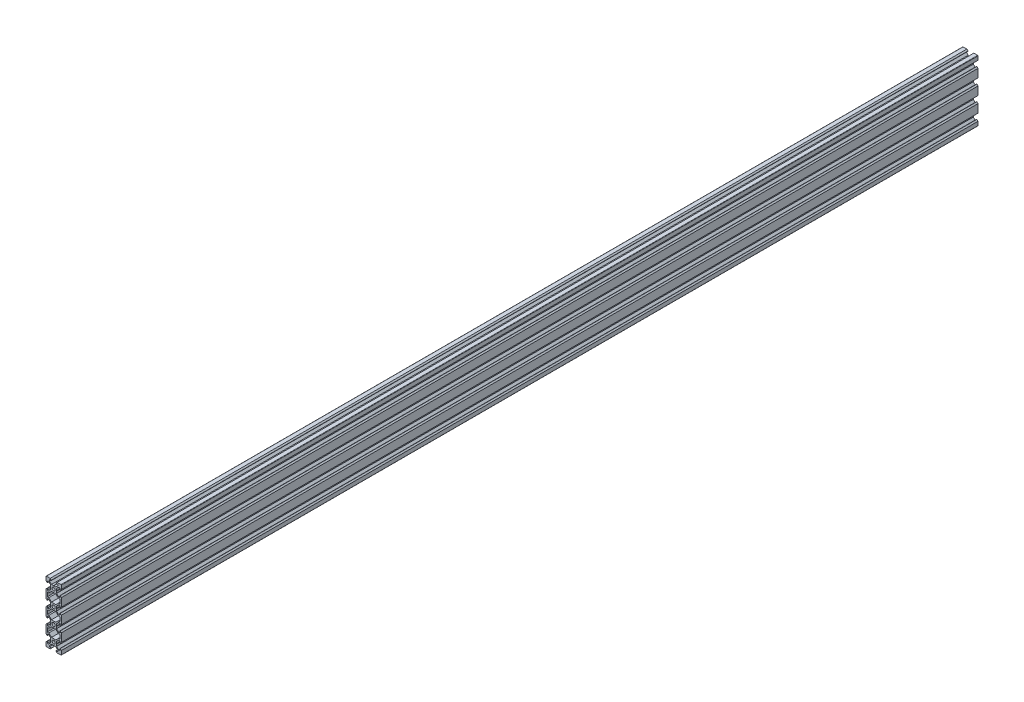
from build123d import *

# Parameters (mm, degrees)
V_SLOT_START                            = -48.53464623
V_SLOT_20X80X1000_LINEAR_RAIL_OUTLINE_R = 2.1
V_SLOT_20X80X1000_LINEAR_RAIL_DEPTH     = 1000
BOSS_EXTRUDE1_START                     = 200
SKETCH1_R                               = 2.1
BOSS_EXTRUDE1_DEPTH                     = 200


# Read off the part's stored shape, not the designer's step: V-Slot 20x80x1000 Linear Rail
with BuildPart() as part:
    # V-Slot 20x80x1000 Linear Rail outline → V-Slot 20x80x1000 Linear Rail (new body)
    with BuildSketch(Plane.XY.offset(V_SLOT_START)):
        with BuildLine():
            Line((20.643413128, 85.594922365), (20.643413128, 88.224262193))
            Line((20.643413128, 88.224262193), (20.433413128, 88.434262193))
            Line((20.433413128, 88.434262193), (20.643413128, 88.644262193))
            Line((20.643413128, 88.644262193), (20.643413128, 91.273602021))
            Line((20.643413128, 91.273602021), (23.3040733, 93.934262193))
            Line((23.3040733, 93.934262193), (24.943413128, 93.934262193))
            Line((24.943413128, 93.934262193), (24.943413128, 91.559262193))
            Line((24.943413128, 91.559262193), (25.288413128, 91.559262193))
            Line((25.288413128, 91.559262193), (26.743413128, 93.014262193))
            Line((26.743413128, 93.014262193), (26.743413128, 97.934262193))
            ThreePointArc((26.743413128, 97.934262193), (26.596966518, 98.287815583), (26.243413128, 98.434262193))
            Line((26.243413128, 98.434262193), (21.323413128, 98.434262193))
            Line((21.323413128, 98.434262193), (19.868413128, 96.979262193))
            Line((19.868413128, 96.979262193), (19.868413128, 96.634262193))
            Line((19.868413128, 96.634262193), (22.243413128, 96.634262193))
            Line((22.243413128, 96.634262193), (22.243413128, 94.994922365))
            Line((22.243413128, 94.994922365), (19.582752956, 92.334262193))
            Line((19.582752956, 92.334262193), (16.953413128, 92.334262193))
            Line((16.953413128, 92.334262193), (16.743413128, 92.124262193))
            Line((16.743413128, 92.124262193), (16.533413128, 92.334262193))
            Line((16.533413128, 92.334262193), (13.9040733, 92.334262193))
            Line((13.9040733, 92.334262193), (11.243413128, 94.994922365))
            Line((11.243413128, 94.994922365), (11.243413128, 96.634262193))
            Line((11.243413128, 96.634262193), (13.618413128, 96.634262193))
            Line((13.618413128, 96.634262193), (13.618413128, 96.979262193))
            Line((13.618413128, 96.979262193), (12.163413128, 98.434262193))
            Line((12.163413128, 98.434262193), (7.243413128, 98.434262193))
            ThreePointArc((7.243413128, 98.434262193), (6.889859737, 98.287815583), (6.743413128, 97.934262193))
            Line((6.743413128, 97.934262193), (6.743413128, 93.014262193))
            Line((6.743413128, 93.014262193), (8.198413128, 91.559262193))
            Line((8.198413128, 91.559262193), (8.543413128, 91.559262193))
            Line((8.543413128, 91.559262193), (8.543413128, 93.934262193))
            Line((8.543413128, 93.934262193), (10.182752956, 93.934262193))
            Line((10.182752956, 93.934262193), (12.843413128, 91.273602021))
            Line((12.843413128, 91.273602021), (12.843413128, 88.644262193))
            Line((12.843413128, 88.644262193), (13.053413128, 88.434262193))
            Line((13.053413128, 88.434262193), (12.843413128, 88.224262193))
            Line((12.843413128, 88.224262193), (12.843413128, 85.594922365))
            Line((12.843413128, 85.594922365), (10.182752956, 82.934262193))
            Line((10.182752956, 82.934262193), (8.543413128, 82.934262193))
            Line((8.543413128, 82.934262193), (8.543413128, 85.309262193))
            Line((8.543413128, 85.309262193), (8.198413128, 85.309262193))
            Line((8.198413128, 85.309262193), (6.743413128, 83.854262193))
            Line((6.743413128, 83.854262193), (6.743413128, 73.014262193))
            Line((6.743413128, 73.014262193), (8.198413128, 71.559262193))
            Line((8.198413128, 71.559262193), (8.543413128, 71.559262193))
            Line((8.543413128, 71.559262193), (8.543413128, 73.934262193))
            Line((8.543413128, 73.934262193), (10.182752956, 73.934262193))
            Line((10.182752956, 73.934262193), (12.843413128, 71.273602021))
            Line((12.843413128, 71.273602021), (12.843413128, 68.644262193))
            Line((12.843413128, 68.644262193), (13.053413128, 68.434262193))
            Line((13.053413128, 68.434262193), (12.843413128, 68.224262193))
            Line((12.843413128, 68.224262193), (12.843413128, 65.594922365))
            Line((12.843413128, 65.594922365), (10.182752956, 62.934262193))
            Line((10.182752956, 62.934262193), (8.543413128, 62.934262193))
            Line((8.543413128, 62.934262193), (8.543413128, 65.309262193))
            Line((8.543413128, 65.309262193), (8.198413128, 65.309262193))
            Line((8.198413128, 65.309262193), (6.743413128, 63.854262193))
            Line((6.743413128, 63.854262193), (6.743413128, 53.014262193))
            Line((6.743413128, 53.014262193), (8.198413128, 51.559262193))
            Line((8.198413128, 51.559262193), (8.543413128, 51.559262193))
            Line((8.543413128, 51.559262193), (8.543413128, 53.934262193))
            Line((8.543413128, 53.934262193), (10.182752956, 53.934262193))
            Line((10.182752956, 53.934262193), (12.843413128, 51.273602021))
            Line((12.843413128, 51.273602021), (12.843413128, 48.644262193))
            Line((12.843413128, 48.644262193), (13.053413128, 48.434262193))
            Line((13.053413128, 48.434262193), (12.843413128, 48.224262193))
            Line((12.843413128, 48.224262193), (12.843413128, 45.594922365))
            Line((12.843413128, 45.594922365), (10.182752956, 42.934262193))
            Line((10.182752956, 42.934262193), (8.543413128, 42.934262193))
            Line((8.543413128, 42.934262193), (8.543413128, 45.309262193))
            Line((8.543413128, 45.309262193), (8.198413128, 45.309262193))
            Line((8.198413128, 45.309262193), (6.743413128, 43.854262193))
            Line((6.743413128, 43.854262193), (6.743413128, 33.014262193))
            Line((6.743413128, 33.014262193), (8.198413128, 31.559262193))
            Line((8.198413128, 31.559262193), (8.543413128, 31.559262193))
            Line((8.543413128, 31.559262193), (8.543413128, 33.934262193))
            Line((8.543413128, 33.934262193), (10.182752956, 33.934262193))
            Line((10.182752956, 33.934262193), (12.843413128, 31.273602021))
            Line((12.843413128, 31.273602021), (12.843413128, 28.644262193))
            Line((12.843413128, 28.644262193), (13.053413128, 28.434262193))
            Line((13.053413128, 28.434262193), (12.843413128, 28.224262193))
            Line((12.843413128, 28.224262193), (12.843413128, 25.594922365))
            Line((12.843413128, 25.594922365), (10.182752956, 22.934262193))
            Line((10.182752956, 22.934262193), (8.543413128, 22.934262193))
            Line((8.543413128, 22.934262193), (8.543413128, 25.309262193))
            Line((8.543413128, 25.309262193), (8.198413128, 25.309262193))
            Line((8.198413128, 25.309262193), (6.743413128, 23.854262193))
            Line((6.743413128, 23.854262193), (6.743413128, 18.934262193))
            ThreePointArc((6.743413128, 18.934262193), (6.889859737, 18.580708802), (7.243413128, 18.434262193))
            Line((7.243413128, 18.434262193), (12.163413128, 18.434262193))
            Line((12.163413128, 18.434262193), (13.618413128, 19.889262193))
            Line((13.618413128, 19.889262193), (13.618413128, 20.234262193))
            Line((13.618413128, 20.234262193), (11.243413128, 20.234262193))
            Line((11.243413128, 20.234262193), (11.243413128, 21.873602021))
            Line((11.243413128, 21.873602021), (13.9040733, 24.534262193))
            Line((13.9040733, 24.534262193), (16.533413128, 24.534262193))
            Line((16.533413128, 24.534262193), (16.743413128, 24.744262193))
            Line((16.743413128, 24.744262193), (16.953413128, 24.534262193))
            Line((16.953413128, 24.534262193), (19.582752956, 24.534262193))
            Line((19.582752956, 24.534262193), (22.243413128, 21.873602021))
            Line((22.243413128, 21.873602021), (22.243413128, 20.234262193))
            Line((22.243413128, 20.234262193), (19.868413128, 20.234262193))
            Line((19.868413128, 20.234262193), (19.868413128, 19.889262193))
            Line((19.868413128, 19.889262193), (21.323413128, 18.434262193))
            Line((21.323413128, 18.434262193), (26.243413128, 18.434262193))
            ThreePointArc((26.243413128, 18.434262193), (26.596966519, 18.580708802), (26.743413128, 18.934262193))
            Line((26.743413128, 18.934262193), (26.743413128, 23.854262193))
            Line((26.743413128, 23.854262193), (25.288413128, 25.309262193))
            Line((25.288413128, 25.309262193), (24.943413128, 25.309262193))
            Line((24.943413128, 25.309262193), (24.943413128, 22.934262193))
            Line((24.943413128, 22.934262193), (23.3040733, 22.934262193))
            Line((23.3040733, 22.934262193), (20.643413128, 25.594922365))
            Line((20.643413128, 25.594922365), (20.643413128, 28.224262193))
            Line((20.643413128, 28.224262193), (20.433413128, 28.434262193))
            Line((20.433413128, 28.434262193), (20.643413128, 28.644262193))
            Line((20.643413128, 28.644262193), (20.643413128, 31.273602021))
            Line((20.643413128, 31.273602021), (23.3040733, 33.934262193))
            Line((23.3040733, 33.934262193), (24.943413128, 33.934262193))
            Line((24.943413128, 33.934262193), (24.943413128, 31.559262193))
            Line((24.943413128, 31.559262193), (25.288413128, 31.559262193))
            Line((25.288413128, 31.559262193), (26.743413128, 33.014262193))
            Line((26.743413128, 33.014262193), (26.743413128, 43.854262193))
            Line((26.743413128, 43.854262193), (25.288413128, 45.309262193))
            Line((25.288413128, 45.309262193), (24.943413128, 45.309262193))
            Line((24.943413128, 45.309262193), (24.943413128, 42.934262193))
            Line((24.943413128, 42.934262193), (23.3040733, 42.934262193))
            Line((23.3040733, 42.934262193), (20.643413128, 45.594922365))
            Line((20.643413128, 45.594922365), (20.643413128, 48.224262193))
            Line((20.643413128, 48.224262193), (20.433413128, 48.434262193))
            Line((20.433413128, 48.434262193), (20.643413128, 48.644262193))
            Line((20.643413128, 48.644262193), (20.643413128, 51.273602021))
            Line((20.643413128, 51.273602021), (23.3040733, 53.934262193))
            Line((23.3040733, 53.934262193), (24.943413128, 53.934262193))
            Line((24.943413128, 53.934262193), (24.943413128, 51.559262193))
            Line((24.943413128, 51.559262193), (25.288413128, 51.559262193))
            Line((25.288413128, 51.559262193), (26.743413128, 53.014262193))
            Line((26.743413128, 53.014262193), (26.743413128, 63.854262193))
            Line((26.743413128, 63.854262193), (25.288413128, 65.309262193))
            Line((25.288413128, 65.309262193), (24.943413128, 65.309262193))
            Line((24.943413128, 65.309262193), (24.943413128, 62.934262193))
            Line((24.943413128, 62.934262193), (23.3040733, 62.934262193))
            Line((23.3040733, 62.934262193), (20.643413128, 65.594922365))
            Line((20.643413128, 65.594922365), (20.643413128, 68.224262193))
            Line((20.643413128, 68.224262193), (20.433413128, 68.434262193))
            Line((20.433413128, 68.434262193), (20.643413128, 68.644262193))
            Line((20.643413128, 68.644262193), (20.643413128, 71.273602021))
            Line((20.643413128, 71.273602021), (23.3040733, 73.934262193))
            Line((23.3040733, 73.934262193), (24.943413128, 73.934262193))
            Line((24.943413128, 73.934262193), (24.943413128, 71.559262193))
            Line((24.943413128, 71.559262193), (25.288413128, 71.559262193))
            Line((25.288413128, 71.559262193), (26.743413128, 73.014262193))
            Line((26.743413128, 73.014262193), (26.743413128, 83.854262193))
            Line((26.743413128, 83.854262193), (25.288413128, 85.309262193))
            Line((25.288413128, 85.309262193), (24.943413128, 85.309262193))
            Line((24.943413128, 85.309262193), (24.943413128, 82.934262193))
            Line((24.943413128, 82.934262193), (23.3040733, 82.934262193))
            Line((23.3040733, 82.934262193), (20.643413128, 85.594922365))
        make_face()
        with Locations((16.743413128, 28.434262193)):
            Circle(V_SLOT_20X80X1000_LINEAR_RAIL_OUTLINE_R, mode=Mode.SUBTRACT)
        Polygon((13.9040733, 32.334262193), (10.5040733, 35.734262193), (8.543413128, 35.734262193), (8.543413128, 41.134262193), (10.5040733, 41.134262193), (13.9040733, 44.534262193), (19.582752956, 44.534262193), (22.982752956, 41.134262193), (24.943413128, 41.134262193), (24.943413128, 35.734262193), (22.982752956, 35.734262193), (19.582752956, 32.334262193), align=None, mode=Mode.SUBTRACT)
        with Locations((16.743413128, 48.434262193)):
            Circle(V_SLOT_20X80X1000_LINEAR_RAIL_OUTLINE_R, mode=Mode.SUBTRACT)
        Polygon((13.9040733, 52.334262193), (10.5040733, 55.734262193), (8.543413128, 55.734262193), (8.543413128, 61.134262193), (10.5040733, 61.134262193), (13.9040733, 64.534262193), (19.582752956, 64.534262193), (22.982752956, 61.134262193), (24.943413128, 61.134262193), (24.943413128, 55.734262193), (22.982752956, 55.734262193), (19.582752956, 52.334262193), align=None, mode=Mode.SUBTRACT)
        with Locations((16.743413128, 68.434262193)):
            Circle(V_SLOT_20X80X1000_LINEAR_RAIL_OUTLINE_R, mode=Mode.SUBTRACT)
        Polygon((13.9040733, 72.334262193), (10.5040733, 75.734262193), (8.543413128, 75.734262193), (8.543413128, 81.134262193), (10.5040733, 81.134262193), (13.9040733, 84.534262193), (19.582752956, 84.534262193), (22.982752956, 81.134262193), (24.943413128, 81.134262193), (24.943413128, 75.734262193), (22.982752956, 75.734262193), (19.582752956, 72.334262193), align=None, mode=Mode.SUBTRACT)
        with Locations((16.743413128, 88.434262193)):
            Circle(V_SLOT_20X80X1000_LINEAR_RAIL_OUTLINE_R, mode=Mode.SUBTRACT)
    extrude(amount=V_SLOT_20X80X1000_LINEAR_RAIL_DEPTH)

    # Sketch1 → Boss-Extrude1 (add)
    with BuildSketch(Plane(origin=(0, 0, -48.53464623), x_dir=(-1, 0, 0), z_dir=(0, 0, -1)).offset(BOSS_EXTRUDE1_START)):
        with BuildLine():
            Line((-20.433413128, 88.434262193), (-20.643413128, 88.224262193))
            Line((-20.643413128, 88.224262193), (-20.643413128, 85.594922365))
            Line((-20.643413128, 85.594922365), (-23.3040733, 82.934262193))
            Line((-23.3040733, 82.934262193), (-24.943413128, 82.934262193))
            Line((-24.943413128, 82.934262193), (-24.943413128, 85.309262193))
            Line((-24.943413128, 85.309262193), (-25.288413128, 85.309262193))
            Line((-25.288413128, 85.309262193), (-26.743413128, 83.854262193))
            Line((-26.743413128, 83.854262193), (-26.743413128, 73.014262193))
            Line((-26.743413128, 73.014262193), (-25.288413128, 71.559262193))
            Line((-25.288413128, 71.559262193), (-24.943413128, 71.559262193))
            Line((-24.943413128, 71.559262193), (-24.943413128, 73.934262193))
            Line((-24.943413128, 73.934262193), (-23.3040733, 73.934262193))
            Line((-23.3040733, 73.934262193), (-20.643413128, 71.273602021))
            Line((-20.643413128, 71.273602021), (-20.643413128, 68.644262193))
            Line((-20.643413128, 68.644262193), (-20.433413128, 68.434262193))
            Line((-20.433413128, 68.434262193), (-20.643413128, 68.224262193))
            Line((-20.643413128, 68.224262193), (-20.643413128, 65.594922365))
            Line((-20.643413128, 65.594922365), (-23.3040733, 62.934262193))
            Line((-23.3040733, 62.934262193), (-24.943413128, 62.934262193))
            Line((-24.943413128, 62.934262193), (-24.943413128, 65.309262193))
            Line((-24.943413128, 65.309262193), (-25.288413128, 65.309262193))
            Line((-25.288413128, 65.309262193), (-26.743413128, 63.854262193))
            Line((-26.743413128, 63.854262193), (-26.743413128, 53.014262193))
            Line((-26.743413128, 53.014262193), (-25.288413128, 51.559262193))
            Line((-25.288413128, 51.559262193), (-24.943413128, 51.559262193))
            Line((-24.943413128, 51.559262193), (-24.943413128, 53.934262193))
            Line((-24.943413128, 53.934262193), (-23.3040733, 53.934262193))
            Line((-23.3040733, 53.934262193), (-20.643413128, 51.273602021))
            Line((-20.643413128, 51.273602021), (-20.643413128, 48.644262193))
            Line((-20.643413128, 48.644262193), (-20.433413128, 48.434262193))
            Line((-20.433413128, 48.434262193), (-20.643413128, 48.224262193))
            Line((-20.643413128, 48.224262193), (-20.643413128, 45.594922365))
            Line((-20.643413128, 45.594922365), (-23.3040733, 42.934262193))
            Line((-23.3040733, 42.934262193), (-24.943413128, 42.934262193))
            Line((-24.943413128, 42.934262193), (-24.943413128, 45.309262193))
            Line((-24.943413128, 45.309262193), (-25.288413128, 45.309262193))
            Line((-25.288413128, 45.309262193), (-26.743413128, 43.854262193))
            Line((-26.743413128, 43.854262193), (-26.743413128, 33.014262193))
            Line((-26.743413128, 33.014262193), (-25.288413128, 31.559262193))
            Line((-25.288413128, 31.559262193), (-24.943413128, 31.559262193))
            Line((-24.943413128, 31.559262193), (-24.943413128, 33.934262193))
            Line((-24.943413128, 33.934262193), (-23.3040733, 33.934262193))
            Line((-23.3040733, 33.934262193), (-20.643413128, 31.273602021))
            Line((-20.643413128, 31.273602021), (-20.643413128, 28.644262193))
            Line((-20.643413128, 28.644262193), (-20.433413128, 28.434262193))
            Line((-20.433413128, 28.434262193), (-20.643413128, 28.224262193))
            Line((-20.643413128, 28.224262193), (-20.643413128, 25.594922365))
            Line((-20.643413128, 25.594922365), (-23.3040733, 22.934262193))
            Line((-23.3040733, 22.934262193), (-24.943413128, 22.934262193))
            Line((-24.943413128, 22.934262193), (-24.943413128, 25.309262193))
            Line((-24.943413128, 25.309262193), (-25.288413128, 25.309262193))
            Line((-25.288413128, 25.309262193), (-26.743413128, 23.854262193))
            Line((-26.743413128, 23.854262193), (-26.743413128, 18.934262193))
            ThreePointArc((-26.743413128, 18.934262193), (-26.596966518, 18.580708802), (-26.243413128, 18.434262193))
            Line((-26.243413128, 18.434262193), (-21.323413128, 18.434262193))
            Line((-21.323413128, 18.434262193), (-19.868413128, 19.889262193))
            Line((-19.868413128, 19.889262193), (-19.868413128, 20.234262193))
            Line((-19.868413128, 20.234262193), (-22.243413128, 20.234262193))
            Line((-22.243413128, 20.234262193), (-22.243413128, 21.873602021))
            Line((-22.243413128, 21.873602021), (-19.582752956, 24.534262193))
            Line((-19.582752956, 24.534262193), (-16.953413128, 24.534262193))
            Line((-16.953413128, 24.534262193), (-16.743413128, 24.744262193))
            Line((-16.743413128, 24.744262193), (-16.533413128, 24.534262193))
            Line((-16.533413128, 24.534262193), (-13.9040733, 24.534262193))
            Line((-13.9040733, 24.534262193), (-11.243413128, 21.873602021))
            Line((-11.243413128, 21.873602021), (-11.243413128, 20.234262193))
            Line((-11.243413128, 20.234262193), (-13.618413128, 20.234262193))
            Line((-13.618413128, 20.234262193), (-13.618413128, 19.889262193))
            Line((-13.618413128, 19.889262193), (-12.163413128, 18.434262193))
            Line((-12.163413128, 18.434262193), (-7.243413128, 18.434262193))
            ThreePointArc((-7.243413128, 18.434262193), (-6.889859737, 18.580708802), (-6.743413128, 18.934262193))
            Line((-6.743413128, 18.934262193), (-6.743413128, 23.854262193))
            Line((-6.743413128, 23.854262193), (-8.198413128, 25.309262193))
            Line((-8.198413128, 25.309262193), (-8.543413128, 25.309262193))
            Line((-8.543413128, 25.309262193), (-8.543413128, 22.934262193))
            Line((-8.543413128, 22.934262193), (-10.182752956, 22.934262193))
            Line((-10.182752956, 22.934262193), (-12.843413128, 25.594922365))
            Line((-12.843413128, 25.594922365), (-12.843413128, 28.224262193))
            Line((-12.843413128, 28.224262193), (-13.053413128, 28.434262193))
            Line((-13.053413128, 28.434262193), (-12.843413128, 28.644262193))
            Line((-12.843413128, 28.644262193), (-12.843413128, 31.273602021))
            Line((-12.843413128, 31.273602021), (-10.182752956, 33.934262193))
            Line((-10.182752956, 33.934262193), (-8.543413128, 33.934262193))
            Line((-8.543413128, 33.934262193), (-8.543413128, 31.559262193))
            Line((-8.543413128, 31.559262193), (-8.198413128, 31.559262193))
            Line((-8.198413128, 31.559262193), (-6.743413128, 33.014262193))
            Line((-6.743413128, 33.014262193), (-6.743413128, 43.854262193))
            Line((-6.743413128, 43.854262193), (-8.198413128, 45.309262193))
            Line((-8.198413128, 45.309262193), (-8.543413128, 45.309262193))
            Line((-8.543413128, 45.309262193), (-8.543413128, 42.934262193))
            Line((-8.543413128, 42.934262193), (-10.182752956, 42.934262193))
            Line((-10.182752956, 42.934262193), (-12.843413128, 45.594922365))
            Line((-12.843413128, 45.594922365), (-12.843413128, 48.224262193))
            Line((-12.843413128, 48.224262193), (-13.053413128, 48.434262193))
            Line((-13.053413128, 48.434262193), (-12.843413128, 48.644262193))
            Line((-12.843413128, 48.644262193), (-12.843413128, 51.273602021))
            Line((-12.843413128, 51.273602021), (-10.182752956, 53.934262193))
            Line((-10.182752956, 53.934262193), (-8.543413128, 53.934262193))
            Line((-8.543413128, 53.934262193), (-8.543413128, 51.559262193))
            Line((-8.543413128, 51.559262193), (-8.198413128, 51.559262193))
            Line((-8.198413128, 51.559262193), (-6.743413128, 53.014262193))
            Line((-6.743413128, 53.014262193), (-6.743413128, 63.854262193))
            Line((-6.743413128, 63.854262193), (-8.198413128, 65.309262193))
            Line((-8.198413128, 65.309262193), (-8.543413128, 65.309262193))
            Line((-8.543413128, 65.309262193), (-8.543413128, 62.934262193))
            Line((-8.543413128, 62.934262193), (-10.182752956, 62.934262193))
            Line((-10.182752956, 62.934262193), (-12.843413128, 65.594922365))
            Line((-12.843413128, 65.594922365), (-12.843413128, 68.224262193))
            Line((-12.843413128, 68.224262193), (-13.053413128, 68.434262193))
            Line((-13.053413128, 68.434262193), (-12.843413128, 68.644262193))
            Line((-12.843413128, 68.644262193), (-12.843413128, 71.273602021))
            Line((-12.843413128, 71.273602021), (-10.182752956, 73.934262193))
            Line((-10.182752956, 73.934262193), (-8.543413128, 73.934262193))
            Line((-8.543413128, 73.934262193), (-8.543413128, 71.559262193))
            Line((-8.543413128, 71.559262193), (-8.198413128, 71.559262193))
            Line((-8.198413128, 71.559262193), (-6.743413128, 73.014262193))
            Line((-6.743413128, 73.014262193), (-6.743413128, 83.854262193))
            Line((-6.743413128, 83.854262193), (-8.198413128, 85.309262193))
            Line((-8.198413128, 85.309262193), (-8.543413128, 85.309262193))
            Line((-8.543413128, 85.309262193), (-8.543413128, 82.934262193))
            Line((-8.543413128, 82.934262193), (-10.182752956, 82.934262193))
            Line((-10.182752956, 82.934262193), (-12.843413128, 85.594922365))
            Line((-12.843413128, 85.594922365), (-12.843413128, 88.224262193))
            Line((-12.843413128, 88.224262193), (-13.053413128, 88.434262193))
            Line((-13.053413128, 88.434262193), (-12.843413128, 88.644262193))
            Line((-12.843413128, 88.644262193), (-12.843413128, 91.273602021))
            Line((-12.843413128, 91.273602021), (-10.182752956, 93.934262193))
            Line((-10.182752956, 93.934262193), (-8.543413128, 93.934262193))
            Line((-8.543413128, 93.934262193), (-8.543413128, 91.559262193))
            Line((-8.543413128, 91.559262193), (-8.198413128, 91.559262193))
            Line((-8.198413128, 91.559262193), (-6.743413128, 93.014262193))
            Line((-6.743413128, 93.014262193), (-6.743413128, 97.934262193))
            ThreePointArc((-6.743413128, 97.934262193), (-6.889859737, 98.287815583), (-7.243413128, 98.434262193))
            Line((-7.243413128, 98.434262193), (-12.163413128, 98.434262193))
            Line((-12.163413128, 98.434262193), (-13.618413128, 96.979262193))
            Line((-13.618413128, 96.979262193), (-13.618413128, 96.634262193))
            Line((-13.618413128, 96.634262193), (-11.243413128, 96.634262193))
            Line((-11.243413128, 96.634262193), (-11.243413128, 94.994922365))
            Line((-11.243413128, 94.994922365), (-13.9040733, 92.334262193))
            Line((-13.9040733, 92.334262193), (-16.533413128, 92.334262193))
            Line((-16.533413128, 92.334262193), (-16.743413128, 92.124262193))
            Line((-16.743413128, 92.124262193), (-16.953413128, 92.334262193))
            Line((-16.953413128, 92.334262193), (-19.582752956, 92.334262193))
            Line((-19.582752956, 92.334262193), (-22.243413128, 94.994922365))
            Line((-22.243413128, 94.994922365), (-22.243413128, 96.634262193))
            Line((-22.243413128, 96.634262193), (-19.868413128, 96.634262193))
            Line((-19.868413128, 96.634262193), (-19.868413128, 96.979262193))
            Line((-19.868413128, 96.979262193), (-21.323413128, 98.434262193))
            Line((-21.323413128, 98.434262193), (-26.243413128, 98.434262193))
            ThreePointArc((-26.243413128, 98.434262193), (-26.596966518, 98.287815583), (-26.743413128, 97.934262193))
            Line((-26.743413128, 97.934262193), (-26.743413128, 93.014262193))
            Line((-26.743413128, 93.014262193), (-25.288413128, 91.559262193))
            Line((-25.288413128, 91.559262193), (-24.943413128, 91.559262193))
            Line((-24.943413128, 91.559262193), (-24.943413128, 93.934262193))
            Line((-24.943413128, 93.934262193), (-23.3040733, 93.934262193))
            Line((-23.3040733, 93.934262193), (-20.643413128, 91.273602021))
            Line((-20.643413128, 91.273602021), (-20.643413128, 88.644262193))
            Line((-20.643413128, 88.644262193), (-20.433413128, 88.434262193))
        make_face()
        with Locations((-16.743413128, 28.434262193)):
            Circle(SKETCH1_R, mode=Mode.SUBTRACT)
        with Locations((-16.743413128, 48.434262193)):
            Circle(SKETCH1_R, mode=Mode.SUBTRACT)
        with Locations((-16.743413128, 68.434262193)):
            Circle(SKETCH1_R, mode=Mode.SUBTRACT)
        with Locations((-16.743413128, 88.434262193)):
            Circle(SKETCH1_R, mode=Mode.SUBTRACT)
        Polygon((-22.982752956, 41.134262193), (-19.582752956, 44.534262193), (-13.9040733, 44.534262193), (-10.5040733, 41.134262193), (-8.543413128, 41.134262193), (-8.543413128, 35.734262193), (-10.5040733, 35.734262193), (-13.9040733, 32.334262193), (-19.582752956, 32.334262193), (-22.982752956, 35.734262193), (-24.943413128, 35.734262193), (-24.943413128, 41.134262193), align=None, mode=Mode.SUBTRACT)
        Polygon((-22.982752956, 61.134262193), (-19.582752956, 64.534262193), (-13.9040733, 64.534262193), (-10.5040733, 61.134262193), (-8.543413128, 61.134262193), (-8.543413128, 55.734262193), (-10.5040733, 55.734262193), (-13.9040733, 52.334262193), (-19.582752956, 52.334262193), (-22.982752956, 55.734262193), (-24.943413128, 55.734262193), (-24.943413128, 61.134262193), align=None, mode=Mode.SUBTRACT)
        Polygon((-22.982752956, 81.134262193), (-19.582752956, 84.534262193), (-13.9040733, 84.534262193), (-10.5040733, 81.134262193), (-8.543413128, 81.134262193), (-8.543413128, 75.734262193), (-10.5040733, 75.734262193), (-13.9040733, 72.334262193), (-19.582752956, 72.334262193), (-22.982752956, 75.734262193), (-24.943413128, 75.734262193), (-24.943413128, 81.134262193), align=None, mode=Mode.SUBTRACT)
    extrude(amount=-BOSS_EXTRUDE1_DEPTH)


solid = part.part
